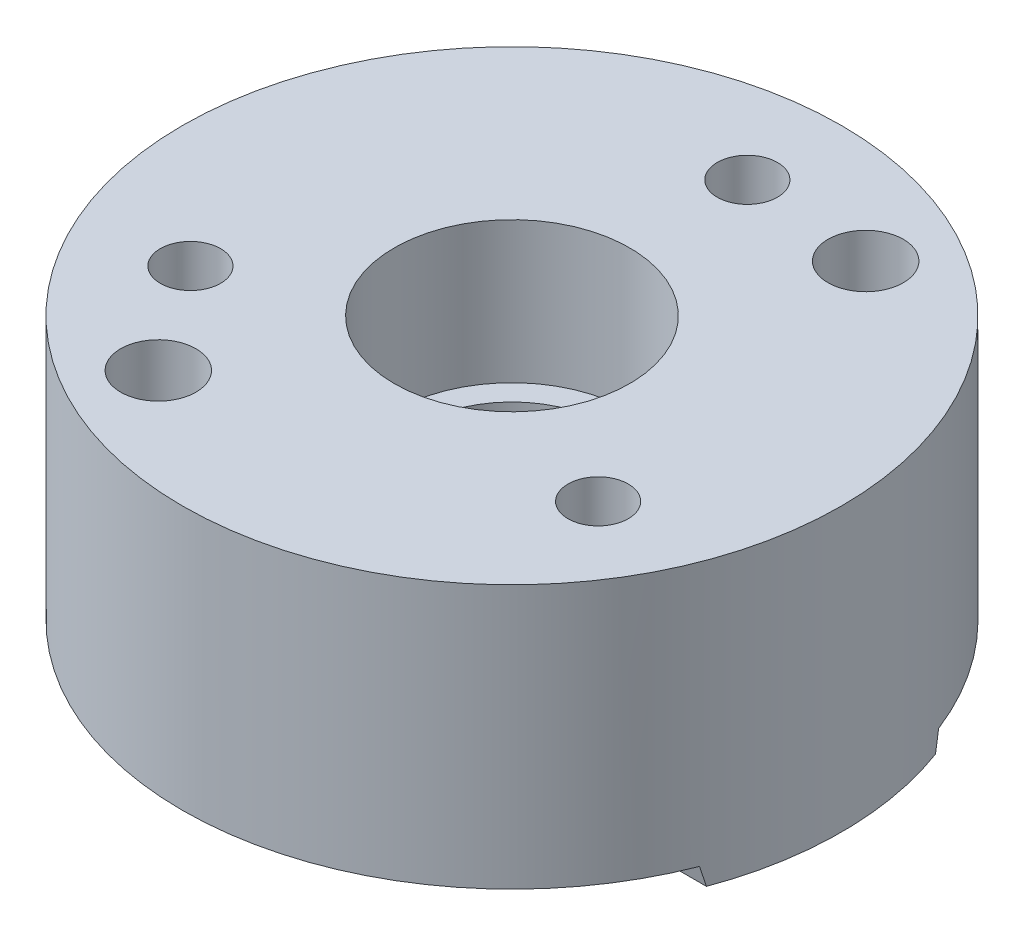
from build123d import *

# Parameters (mm, degrees)
SKETCH1_R                                           = 35
SKETCH1_R_2                                         = 10
BOSS_EXTRUDE1_DEPTH                                 = 30
SKETCH4_R                                           = 12.5
CUT_EXTRUDE2_DEPTH                                  = 15
CBORE_FOR_M6_HEX_SOCKET_HEAD_CAP_SCREW1_D           = 6.4
CBORE_FOR_M6_HEX_SOCKET_HEAD_CAP_SCREW1_CBORE_D     = 11
CBORE_FOR_M6_HEX_SOCKET_HEAD_CAP_SCREW1_CBORE_DEPTH = 8.4
F_8_0MM_DOWEL_HOLE1_D                               = 8
SKETCH14_OUTSIDE_W                                  = 92.688
SKETCH14_OUTSIDE_H                                  = 92.688
SKETCH14_OUTSIDE_W_2                                = 70
SKETCH14_OUTSIDE_H_2                                = 25.4
CUT_EXTRUDE3_DEPTH                                  = 2
SKETCH18_R                                          = 4.25
CUT_EXTRUDE5_DEPTH                                  = 6
CUT_EXTRUDE6_DEPTH                                  = 58.879184514
CUT_EXTRUDE6_DEPTH_BACK                             = 58.879184514


with BuildPart() as part:
    # Sketch1 → Boss-Extrude1 (new body)
    with BuildSketch(Plane(origin=(0, 0, 0), x_dir=(1, 0, 0), z_dir=(0, 1, 0))):
        Circle(SKETCH1_R)
        Circle(SKETCH1_R_2, mode=Mode.SUBTRACT)
    extrude(amount=-BOSS_EXTRUDE1_DEPTH)

    # Sketch4 → Cut-Extrude2 (cut)
    with BuildSketch(Plane(origin=(0, 0, 0), x_dir=(1, 0, 0), z_dir=(0, 1, 0))):
        Circle(SKETCH4_R)
    extrude(amount=-CUT_EXTRUDE2_DEPTH, mode=Mode.SUBTRACT)

    # CBORE for M6 Hex Socket Head Cap Screw1 (through all)
    with Locations(Plane(origin=(0, -30, 0), x_dir=(-1, 0, 0), z_dir=(0, -1, 0))):
        with Locations((0, 25), (21.650635095, -12.5), (-21.650635095, -12.5)):
            CounterBoreHole(CBORE_FOR_M6_HEX_SOCKET_HEAD_CAP_SCREW1_D / 2, CBORE_FOR_M6_HEX_SOCKET_HEAD_CAP_SCREW1_CBORE_D / 2, CBORE_FOR_M6_HEX_SOCKET_HEAD_CAP_SCREW1_CBORE_DEPTH)

    # Ø8.0mm Dowel Hole1 (through all)
    with Locations(Plane(origin=(0, -30, 0), x_dir=(-1, 0, 0), z_dir=(0, -1, 0))):
        with Locations((13.75, -23.815698604), (-13.75, 23.815698604)):
            Hole(F_8_0MM_DOWEL_HOLE1_D / 2)

    # Sketch14 outside → Cut-Extrude3 (cut)
    with BuildSketch(Plane.XZ.offset(30)):
        Rectangle(SKETCH14_OUTSIDE_W, SKETCH14_OUTSIDE_H)
        Rectangle(SKETCH14_OUTSIDE_W_2, SKETCH14_OUTSIDE_H_2, mode=Mode.SUBTRACT)
    extrude(amount=-CUT_EXTRUDE3_DEPTH, mode=Mode.SUBTRACT)

    # Sketch18 → Cut-Extrude5 (cut)
    with BuildSketch(Plane.XZ.offset(30)):
        with Locations((-25.9, 0)):
            Circle(SKETCH18_R)
    extrude(amount=-CUT_EXTRUDE5_DEPTH, mode=Mode.SUBTRACT)

    # Sketch19 → Cut-Extrude6 (cut, two sides: drawn at the far end of the back side and taken through both)
    with BuildSketch(Plane(origin=(0, 0, 0), x_dir=(0, 0, -1), z_dir=(1, 0, 0)).offset(-CUT_EXTRUDE6_DEPTH_BACK)):
        Polygon((-12.7, -28), (-12.164101615, -30), (-12.7, -30), align=None)
        Polygon((12.7, -28), (12.164101615, -30), (12.7, -30), align=None)
    extrude(amount=CUT_EXTRUDE6_DEPTH + CUT_EXTRUDE6_DEPTH_BACK, mode=Mode.SUBTRACT)


solid = part.part
